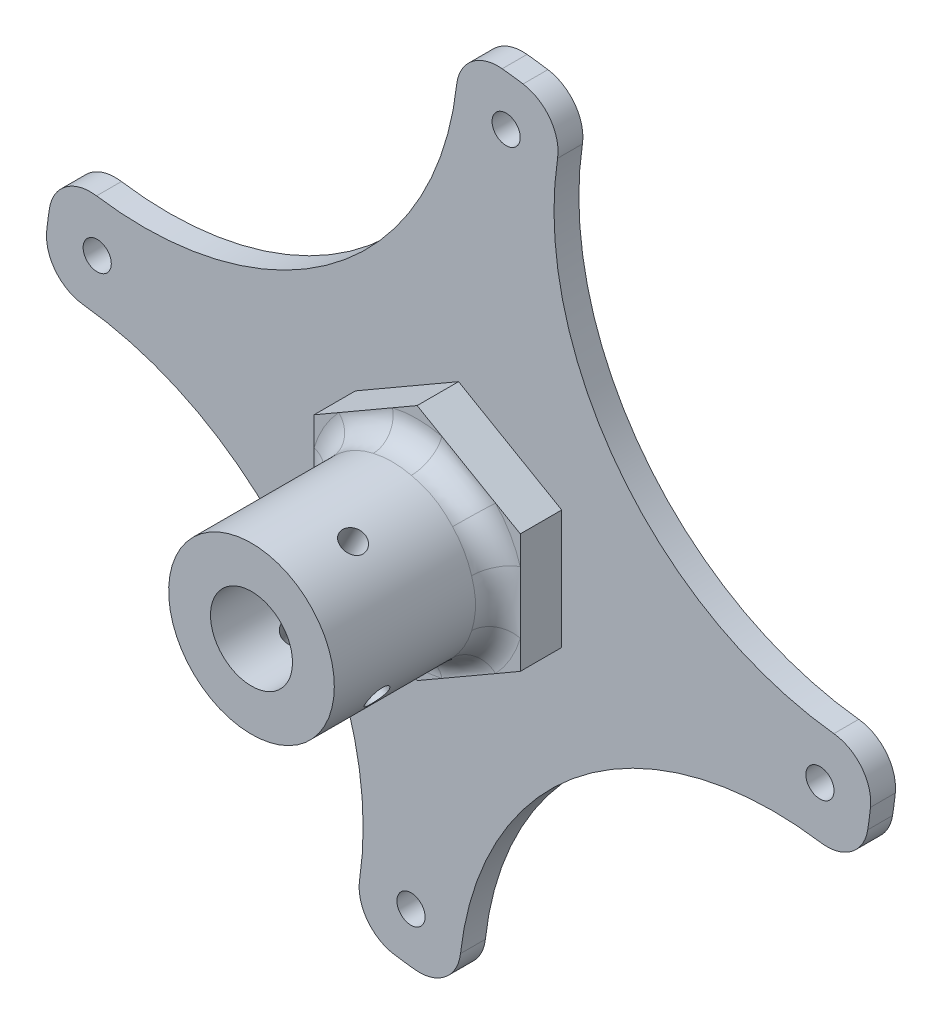
from build123d import *

# Parameters (mm, degrees)
SKETCH1_R                           = 50
BOSS_EXTRUDE1_DEPTH                 = 3
BOSS_EXTRUDE2_DEPTH                 = 5
SKETCH3_R                           = 10
BOSS_EXTRUDE3_DEPTH                 = 20
FILLET1_R                           = 3
SKETCH4_R                           = 4.95
CUT_EXTRUDE1_DEPTH                  = 77.052613367
F_1_0MM_DOWEL_HOLE1_D               = 2.8
F_1_0MM_DOWEL_HOLE1_DEPTH           = 33.158795133
F_1_0MM_DOWEL_HOLE1_TIP             = 0.841204867
F_1_0MM_DOWEL_HOLE1_ON_FACE_2_D     = 2.8
F_1_0MM_DOWEL_HOLE1_ON_FACE_2_DEPTH = 33.158795133
F_1_0MM_DOWEL_HOLE1_ON_FACE_2_TIP   = 0.841204867
CUT_EXTRUDE2_START                  = -25
CUT_EXTRUDE2_DEPTH                  = 25
FILLET2_R                           = 5
F_1_0MM_DOWEL_HOLE2_D               = 3.4
F_1_0MM_DOWEL_HOLE2_DEPTH           = 32.978536948
F_1_0MM_DOWEL_HOLE2_TIP             = 1.021463052


with BuildPart() as part:
    # Sketch1 → Boss-Extrude1 (new body)
    with BuildSketch(Plane.XY):
        Circle(SKETCH1_R)
    extrude(amount=BOSS_EXTRUDE1_DEPTH)

    # Sketch2 → Boss-Extrude2 (add)
    with BuildSketch(Plane.XY.offset(3)):
        Polygon((12.45, -7.188010851), (12.45, 7.188010851), (0, 14.376021703), (-12.45, 7.188010851), (-12.45, -7.188010851), (0, -14.376021703), align=None)
    extrude(amount=BOSS_EXTRUDE2_DEPTH)

    # Sketch3 → Boss-Extrude3 (add)
    with BuildSketch(Plane.XY.offset(8)):
        Circle(SKETCH3_R)
    extrude(amount=BOSS_EXTRUDE3_DEPTH)

    # Fillet1
    fillet1_edges = [part.edges().sort_by_distance(p)[0] for p in [
        (-10, 0, 8),
    ]]
    fillet(fillet1_edges, radius=FILLET1_R)

    # Sketch4 → Cut-Extrude1 (cut, through all)
    with BuildSketch(Plane.XY.offset(28)):
        Circle(SKETCH4_R)
    extrude(amount=-CUT_EXTRUDE1_DEPTH, mode=Mode.SUBTRACT)

    # Ø1.0mm Dowel Hole1
    with Locations(Plane(origin=(-8.66652473, 4.98912308, 21.499193451), x_dir=(-0.49891230804, -0.866652472959, 0), z_dir=(-0.866652472959, 0.49891230804, 0))):
        with Locations((-1e-09, 0)):
            Hole(F_1_0MM_DOWEL_HOLE1_D / 2, depth=F_1_0MM_DOWEL_HOLE1_DEPTH)
            with Locations((0, 0, -(F_1_0MM_DOWEL_HOLE1_DEPTH + F_1_0MM_DOWEL_HOLE1_TIP / 2))):  # 118° drill point
                Cone(0, F_1_0MM_DOWEL_HOLE1_D / 2, F_1_0MM_DOWEL_HOLE1_TIP, mode=Mode.SUBTRACT)

    # Ø1.0mm Dowel Hole1 on face 2
    with Locations(Plane(origin=(4.73855937, 8.806023796, 20.457550219), x_dir=(0.880602268082, -0.473856144256, 0), z_dir=(0.473856144256, 0.880602268082, 0))):
        with Locations((0, 0)):
            Hole(F_1_0MM_DOWEL_HOLE1_ON_FACE_2_D / 2, depth=F_1_0MM_DOWEL_HOLE1_ON_FACE_2_DEPTH)
            with Locations((0, 0, -(F_1_0MM_DOWEL_HOLE1_ON_FACE_2_DEPTH + F_1_0MM_DOWEL_HOLE1_ON_FACE_2_TIP / 2))):  # 118° drill point
                Cone(0, F_1_0MM_DOWEL_HOLE1_ON_FACE_2_D / 2, F_1_0MM_DOWEL_HOLE1_ON_FACE_2_TIP, mode=Mode.SUBTRACT)

    # Sketch6 → Cut-Extrude2 (cut)
    with BuildSketch(Plane.XY.offset(3).offset(CUT_EXTRUDE2_START)):
        with BuildLine():
            Line((-49.037179863, 0), (-50, 0))
            ThreePointArc((-50, 0), (-39.667667015, -30.43807145), (-12.940952255, -48.296291314))
            ThreePointArc((-12.940952255, -48.296291314), (-19.080518481, -15.247800886), (-49.037179863, 0))
        make_face()
        with BuildLine():
            ThreePointArc((0, 50), (-30.43807145, 39.667667015), (-48.296291314, 12.940952255))
            Line((-48.296291314, 12.940952255), (-47.366278478, 12.691756067))
            ThreePointArc((-47.366278478, 12.691756067), (-14.483944315, 19.666646244), (0, 50))
        make_face()
        with BuildLine():
            ThreePointArc((48.296291314, -12.940952255), (14.864016159, -19.371163), (0, -50))
            ThreePointArc((0, -50), (30.43807145, -39.667667015), (48.296291314, -12.940952255))
        make_face()
        with BuildLine():
            ThreePointArc((50, 0), (39.667667015, 30.43807145), (12.940952255, 48.296291314))
            ThreePointArc((12.940952255, 48.296291314), (19.371163, 14.864016159), (50, 0))
        make_face()
    extrude(amount=CUT_EXTRUDE2_DEPTH, mode=Mode.SUBTRACT)

    # Fillet2
    fillet2_edges = [part.edges().sort_by_distance(p)[0] for p in [
        (-48.296291314, 12.940952255, 1.5),
        (-50, 0, 1.5),
        (-12.940952255, -48.296291314, 1.5),
        (0, -50, 1.5),
        (48.296291314, -12.940952255, 1.5),
        (50, 0, 1.5),
        (0, 50, 1.5),
        (12.940952255, 48.296291314, 1.5),
    ]]
    fillet(fillet2_edges, radius=FILLET2_R)

    # Ø1.0mm Dowel Hole2
    with Locations(Plane(origin=(5.743152458, 43.6235739, 0), x_dir=(-1, 0, 0), z_dir=(0, 0, -1))):
        with Locations((0, 0), (49.366726358, -37.880421442), (11.486304916, -87.2471478), (-37.880421442, -49.366726358)):
            Hole(F_1_0MM_DOWEL_HOLE2_D / 2, depth=F_1_0MM_DOWEL_HOLE2_DEPTH)
            with Locations((0, 0, -(F_1_0MM_DOWEL_HOLE2_DEPTH + F_1_0MM_DOWEL_HOLE2_TIP / 2))):  # 118° drill point
                Cone(0, F_1_0MM_DOWEL_HOLE2_D / 2, F_1_0MM_DOWEL_HOLE2_TIP, mode=Mode.SUBTRACT)


solid = part.part
